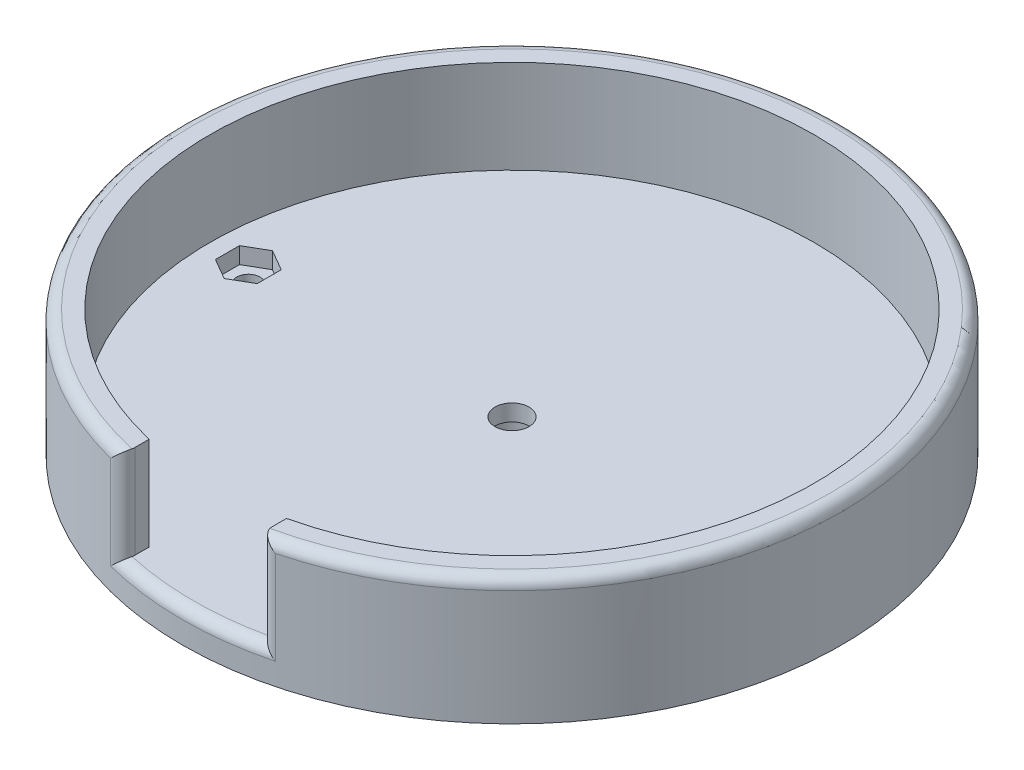
from build123d import *

# Parameters (mm, degrees)
SKETCH1_R           = 60
SKETCH1_R_2         = 2.1
SKETCH1_R_3         = 3.1
BOSS_EXTRUDE1_DEPTH = 6
CUT_EXTRUDE1_DEPTH  = 3
SKETCH3_R           = 4.8
CUT_EXTRUDE2_DEPTH  = 3
SKETCH4_R           = 60
SKETCH4_R_2         = 55
BOSS_EXTRUDE2_DEPTH = 17
SKETCH5_W           = 25
SKETCH5_H           = 35
CUT_EXTRUDE3_DEPTH  = 87.539008545
FILLET1_R           = 2


with BuildPart() as part:
    # Sketch1 → Boss-Extrude1 (new body)
    with BuildSketch(Plane(origin=(0, 0, 0), x_dir=(1, 0, 0), z_dir=(0, 1, 0))):
        with Locations(Location((0, 0, 0), (0, 0, 270))):
            Circle(SKETCH1_R)
        with Locations(Location((-48, 0, 0), (0, 0, 270))):
            Circle(SKETCH1_R_2, mode=Mode.SUBTRACT)
        with Locations(Location((0, 0, 0), (0, 0, 270))):
            Circle(SKETCH1_R_3, mode=Mode.SUBTRACT)
        with Locations(Location((48, 0, 0), (0, 0, 90))):
            Circle(SKETCH1_R_2, mode=Mode.SUBTRACT)
    extrude(amount=BOSS_EXTRUDE1_DEPTH)

    # Sketch2 → Cut-Extrude1 (cut)
    with BuildSketch(Plane(origin=(0, 6, 0), x_dir=(1, 0, 0), z_dir=(0, 1, 0))):
        Polygon((-51.8, 2.193931023), (-51.8, -2.193931023), (-48, -4.387862046), (-44.2, -2.193931023), (-44.2, 2.193931023), (-48, 4.387862046), align=None)
        Polygon((48, 4.387862046), (51.8, 2.193931023), (51.8, -2.193931023), (48, -4.387862046), (44.2, -2.193931023), (44.2, 2.193931023), align=None)
    extrude(amount=-CUT_EXTRUDE1_DEPTH, mode=Mode.SUBTRACT)

    # Sketch3 → Cut-Extrude2 (cut)
    with BuildSketch(Plane.XZ):
        with Locations(Location((0, 0, 0), (0, 0, 270))):
            Circle(SKETCH3_R)
    extrude(amount=-CUT_EXTRUDE2_DEPTH, mode=Mode.SUBTRACT)

    # Sketch4 → Boss-Extrude2 (add)
    with BuildSketch(Plane(origin=(0, 6, 0), x_dir=(1, 0, 0), z_dir=(0, 1, 0))):
        with Locations(Location((0, 0, 0), (0, 0, 270))):
            Circle(SKETCH4_R)
        with Locations(Location((0, 0, 0), (0, 0, 270))):
            Circle(SKETCH4_R_2, mode=Mode.SUBTRACT)
    extrude(amount=BOSS_EXTRUDE2_DEPTH)

    # Sketch5 → Cut-Extrude3 (cut, through all)
    with BuildSketch(Plane(origin=(0, 6, 0), x_dir=(1, 0, 0), z_dir=(0, 1, 0))):
        with Locations((0, -50)):
            Rectangle(SKETCH5_W, SKETCH5_H)
    extrude(amount=CUT_EXTRUDE3_DEPTH, mode=Mode.SUBTRACT)

    # Fillet1
    # the kernel refuses this fillet: 2 mm, written as the material it takes off along each edge
    with BuildSketch(Plane(origin=(0, 23, 0), x_dir=(0.12573543795396686, 0, 0.9920638082515278), z_dir=(-0.9920638082515278, 0, 0.12573543795396686))) as fillet1_piece_1:
        with BuildLine():
            CenterArc((60 - FILLET1_R, -FILLET1_R), FILLET1_R, 0, 90)
            Line((60 - FILLET1_R, 0), (60, 0))
            Line((60, 0), (60, -FILLET1_R))
        make_face()
    revolve(axis=Axis((0, 23, 0), (0, 1, 0)), revolution_arc=345.553543265, mode=Mode.SUBTRACT)
    with BuildSketch(Plane(origin=(-12.5, 29.420959094, 58.683472972), x_dir=(-0.973374835212885, 0, -0.2292191749707888), z_dir=(0, -1, 0))) as fillet1_piece_2:
        with BuildLine():
            CenterArc((2.525577244, 1.999541851), FILLET1_R, 166.748894317, 104.477512186)
            Line((0.578827573, 2.457980201), (0, 0))
            ThreePointArc((0, 0), (1.284191819, -0.013744479), (2.568383638, 0))
        make_face()
    extrude(amount=23.420959094, mode=Mode.SUBTRACT)
    with BuildSketch(Plane(origin=(12.5, 29.420959094, 58.683472972), x_dir=(0.9733748352128844, 0, -0.22921917497079108), z_dir=(0, -1, 0))) as fillet1_piece_3:
        with BuildLine():
            CenterArc((2.525577244, -1.999541851), FILLET1_R, 88.773593497, 104.477512186)
            Line((0.578827573, -2.457980201), (0, 0))
            ThreePointArc((0, 0), (1.284191819, 0.013744479), (2.568383638, 0))
        make_face()
    extrude(amount=23.420959094, mode=Mode.SUBTRACT)
    with BuildSketch(Plane(origin=(0, 6, 0), x_dir=(0.2890214661785548, 0, 0.9573226165133667), z_dir=(0.9573226165133667, 0, -0.2890214661785548))) as fillet1_piece_4_section:
        with BuildLine():
            CenterArc((60 - FILLET1_R, FILLET1_R), FILLET1_R, 270, 90)
            Line((60 - FILLET1_R, 0), (60, 0))
            Line((60, 0), (60, FILLET1_R))
        make_face()
    fillet1_piece_4 = revolve(axis=Axis((0, 6, 0), (0, -1, 0)), revolution_arc=16.799381702, mode=Mode.PRIVATE)
    fillet1_piece_4 = split(fillet1_piece_4, bisect_by=Plane(origin=(12.5, 5.547238018, 59.104221097), z_dir=(-1, 0, 0)), keep=Keep.TOP, mode=Mode.PRIVATE)
    add(fillet1_piece_4, mode=Mode.SUBTRACT)
    with BuildSketch(Plane(origin=(0, 6, 0), x_dir=(0, 0, 1), z_dir=(1, 0, 0))) as fillet1_piece_5_section:
        with BuildLine():
            CenterArc((60 - FILLET1_R, FILLET1_R), FILLET1_R, 270, 90)
            Line((60 - FILLET1_R, 0), (60, 0))
            Line((60, 0), (60, FILLET1_R))
        make_face()
    fillet1_piece_5 = revolve(axis=Axis((0, 6, 0), (0, -1, 0)), revolution_arc=16.799381702, mode=Mode.PRIVATE)
    fillet1_piece_5 = split(fillet1_piece_5, bisect_by=Plane(origin=(-12.5, 5.5472381, 59.104220547), z_dir=(1, 0, 0)), keep=Keep.TOP, mode=Mode.PRIVATE)
    add(fillet1_piece_5, mode=Mode.SUBTRACT)
    with BuildSketch(Plane(origin=(0, 6, 0), x_dir=(0, 0, 1), z_dir=(1, 0, 0))) as fillet1_piece_6a_section:
        with BuildLine():
            CenterArc((60 - FILLET1_R, FILLET1_R), FILLET1_R, 270, 90)
            Line((60 - FILLET1_R, 0), (60, 0))
            Line((60, 0), (60, FILLET1_R))
        make_face()
    fillet1_piece_6a = revolve(axis=Axis((0, 6, 0), (0, -1, 0)), revolution_arc=16.799381702, mode=Mode.PRIVATE)
    fillet1_piece_6a = split(fillet1_piece_6a, bisect_by=Plane(origin=(-12.5, 5.540518873, 57.656474574), z_dir=(-1, 0, 0)), keep=Keep.TOP, mode=Mode.PRIVATE)
    with BuildSketch(Plane(origin=(-12.5, 29.420959094, 58.683472972), x_dir=(-0.973374835212885, 0, -0.2292191749707888), z_dir=(0, -1, 0))) as fillet1_piece_6b_section:
        with BuildLine():
            CenterArc((2.525577244, 1.999541851), FILLET1_R, 166.748894317, 104.477512186)
            Line((0.578827573, 2.457980201), (0, 0))
            ThreePointArc((0, 0), (1.284191819, -0.013744479), (2.568383638, 0))
        make_face()
    fillet1_piece_6b = extrude(amount=29.841918188, mode=Mode.PRIVATE)
    fillet1_piece_6b = split(fillet1_piece_6b, bisect_by=Plane(origin=(-13.085266846, 6, 57.965433437), z_dir=(0, -1, 0)), keep=Keep.TOP, mode=Mode.PRIVATE)
    fillet1_piece_6 = fillet1_piece_6a & fillet1_piece_6b
    add(fillet1_piece_6, mode=Mode.SUBTRACT)
    with BuildSketch(Plane(origin=(12.5, 29.420959094, 58.683472972), x_dir=(0.9733748352128844, 0, -0.22921917497079108), z_dir=(0, -1, 0))) as fillet1_piece_7a_section:
        with BuildLine():
            CenterArc((2.525577244, -1.999541851), FILLET1_R, 88.773593497, 104.477512186)
            Line((0.578827573, -2.457980201), (0, 0))
            ThreePointArc((0, 0), (1.284191819, 0.013744479), (2.568383638, 0))
        make_face()
    fillet1_piece_7a = extrude(amount=29.841918188, mode=Mode.PRIVATE)
    fillet1_piece_7a = split(fillet1_piece_7a, bisect_by=Plane(origin=(13.085266846, 6, 57.965433437), z_dir=(0, -1, 0)), keep=Keep.TOP, mode=Mode.PRIVATE)
    with BuildSketch(Plane(origin=(0, 6, 0), x_dir=(0.2890214661785548, 0, 0.9573226165133667), z_dir=(0.9573226165133667, 0, -0.2890214661785548))) as fillet1_piece_7b_section:
        with BuildLine():
            CenterArc((60 - FILLET1_R, FILLET1_R), FILLET1_R, 270, 90)
            Line((60 - FILLET1_R, 0), (60, 0))
            Line((60, 0), (60, FILLET1_R))
        make_face()
    fillet1_piece_7b = revolve(axis=Axis((0, 6, 0), (0, -1, 0)), revolution_arc=16.799381702, mode=Mode.PRIVATE)
    fillet1_piece_7b = split(fillet1_piece_7b, bisect_by=Plane(origin=(12.5, 5.540518947, 57.656474329), z_dir=(1, 0, 0)), keep=Keep.TOP, mode=Mode.PRIVATE)
    fillet1_piece_7 = fillet1_piece_7a & fillet1_piece_7b
    add(fillet1_piece_7, mode=Mode.SUBTRACT)


solid = part.part
